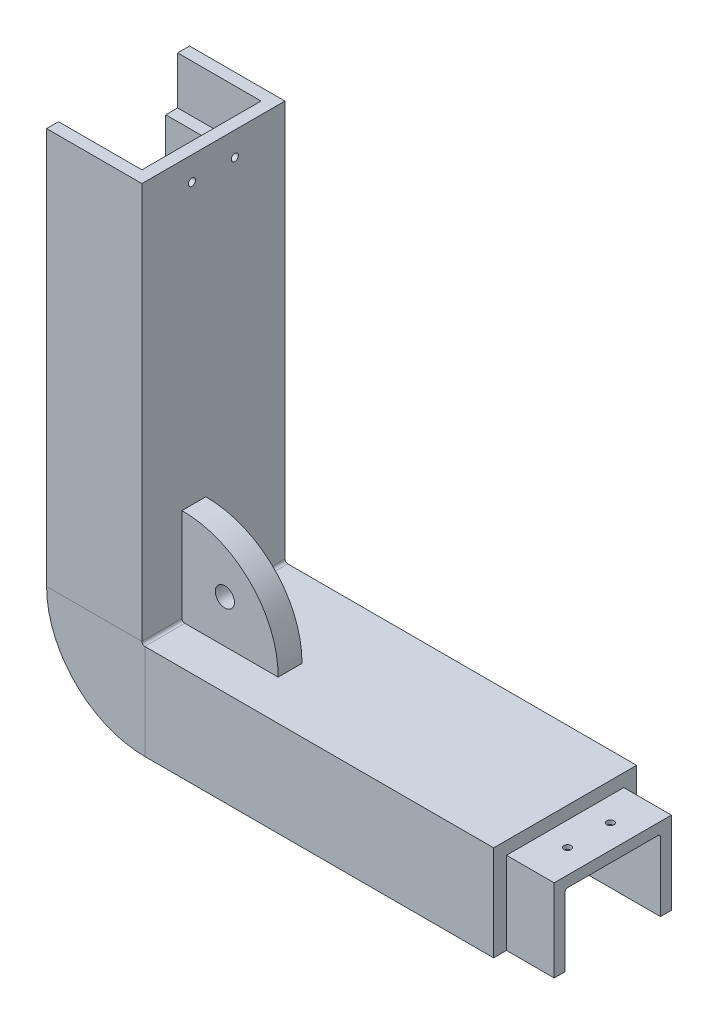
from build123d import *

# Parameters (mm, degrees)
BOSS_EXTRUDE2_START  = 12.7
BOSS_EXTRUDE2_DEPTH  = 12.7
BOSS_EXTRUDE3_DEPTH  = 12.7
SKETCH8_R            = 0.9525
CUT_EXTRUDE1_DEPTH   = 157.544227843
SKETCH9_R            = 0.9525
CUT_EXTRUDE2_DEPTH   = 164.292861742
SKETCH12_R           = 2.5527
BOSS_EXTRUDE10_DEPTH = 3.175


with BuildPart() as part:
    # Sweep1: sweep along a path in Sketch4
    with BuildLine(Plane.XY) as sweep1_path:
        Line((0, 0), (0, -92.964))
        ThreePointArc((0, -92.964), (0.223184633, -93.502815367), (0.762, -93.726))
        Line((0.762, -93.726), (93.726, -93.726))
    # Sketch3 → Sweep1 (sweep)
    with BuildSketch(Plane(origin=(0, 0, 0), x_dir=(1, 0, 0), z_dir=(0, 1, 0))):
        with BuildLine():
            Line((0, 16.62500014), (-25.4, 16.62500014))
            Line((-25.4, 16.62500014), (-25.4, 10.27500014))
            Line((-25.4, 10.27500014), (-6.985, 10.27500014))
            ThreePointArc((-6.985, 10.27500014), (-6.535987194, 10.089012946), (-6.35, 9.64000014))
            Line((-6.35, 9.64000014), (-6.35, -14.48999986))
            ThreePointArc((-6.35, -14.48999986), (-6.535987194, -14.939012666), (-6.985, -15.12499986))
            Line((-6.985, -15.12499986), (-25.4, -15.12499986))
            Line((-25.4, -15.12499986), (-25.4, -21.47499986))
            Line((-25.4, -21.47499986), (0, -21.47499986))
            Line((0, -21.47499986), (0, 16.62500014))
        make_face()
    sweep(path=sweep1_path.line)

    # Sketch6 → Boss-Extrude2 (add)
    with BuildSketch(Plane(origin=(93.726, 0, 0), x_dir=(0, 0, -1), z_dir=(1, 0, 0)).offset(BOSS_EXTRUDE2_START)):
        with BuildLine():
            Line((-18.04599986, -97.155), (13.19600014, -97.155))
            Line((13.19600014, -97.155), (13.19600014, -119.126))
            Line((13.19600014, -119.126), (10.27500014, -119.126))
            Line((10.27500014, -119.126), (10.27500014, -100.711))
            ThreePointArc((10.27500014, -100.711), (10.089012946, -100.261987194), (9.64000014, -100.076))
            Line((9.64000014, -100.076), (-14.48999986, -100.076))
            ThreePointArc((-14.48999986, -100.076), (-14.939012666, -100.261987194), (-15.12499986, -100.711))
            Line((-15.12499986, -100.711), (-15.12499986, -119.126))
            Line((-15.12499986, -119.126), (-18.04599986, -119.126))
            Line((-18.04599986, -119.126), (-18.04599986, -97.155))
        make_face()
    extrude(amount=-BOSS_EXTRUDE2_DEPTH)

    # Sketch7 → Boss-Extrude3 (add)
    with BuildSketch(Plane(origin=(0, 0, 0), x_dir=(1, 0, 0), z_dir=(0, 1, 0))):
        Polygon((-25.4, 13.45000014), (-25.4, 16.62500014), (0, 16.62500014), (0, -21.47499986), (-25.4, -21.47499986), (-25.4, -18.29999986), (-3.175, -18.29999986), (-3.175, 13.45000014), align=None)
    extrude(amount=BOSS_EXTRUDE3_DEPTH)

    # Sketch8 → Cut-Extrude1 (cut, through all)
    with BuildSketch(Plane.XZ.offset(100.076)):
        with Locations((100.076, 8.13999986)):
            Circle(SKETCH8_R)
        with Locations((100.076, -3.29000014)):
            Circle(SKETCH8_R)
    extrude(amount=-CUT_EXTRUDE1_DEPTH, mode=Mode.SUBTRACT)

    # Sketch9 → Cut-Extrude2 (cut, through all)
    with BuildSketch(Plane.ZY.offset(3.175)):
        with Locations((-3.29000014, 6.35)):
            Circle(SKETCH9_R)
        with Locations((8.13999986, 6.35)):
            Circle(SKETCH9_R)
    extrude(amount=-CUT_EXTRUDE2_DEPTH, mode=Mode.SUBTRACT)

    # Sketch12 → Boss-Extrude10 (add, symmetric)
    with BuildSketch(Plane.XY.offset(7.62)):
        with BuildLine():
            Line((0.762, -93.726), (25.622204075, -93.726))
            ThreePointArc((25.622204075, -93.726), (18.183696875, -75.542303125), (0, -68.103795925))
            Line((0, -68.103795925), (0, -92.964))
            ThreePointArc((0, -92.964), (0.223184633, -93.502815367), (0.762, -93.726))
        make_face()
        with Locations((11.43, -82.296)):
            Circle(SKETCH12_R, mode=Mode.SUBTRACT)
    extrude(amount=BOSS_EXTRUDE10_DEPTH, both=True)

    # Sketch14 → CSK for _6 Flat Head Machine Screw _100 (revolve, cut)
    with BuildSketch(Plane(origin=(100.076, -100.076, -3.29000014), x_dir=(0, 0, -1), z_dir=(1, 0, 0))):
        Polygon((0, 0), (0, 2.410824014), (1.89865, 1.27), (1.89865, 1.380025208), (3.5433, 0), align=None)
    revolve(axis=Axis((100.076, -106.426, -3.29000014), (0, 1, 0)), mode=Mode.SUBTRACT)

    # Sketch16 → CSK for _6 Flat Head Machine Screw _ 2 (revolve, cut)
    with BuildSketch(Plane(origin=(100.076, -100.076, 8.13999986), x_dir=(0, 0, -1), z_dir=(1, 0, 0))):
        Polygon((0, 0), (0, 2.410824014), (1.89865, 1.27), (1.89865, 1.380025208), (3.5433, 0), align=None)
    revolve(axis=Axis((100.076, -106.426, 8.13999986), (0, 1, 0)), mode=Mode.SUBTRACT)


solid = part.part
